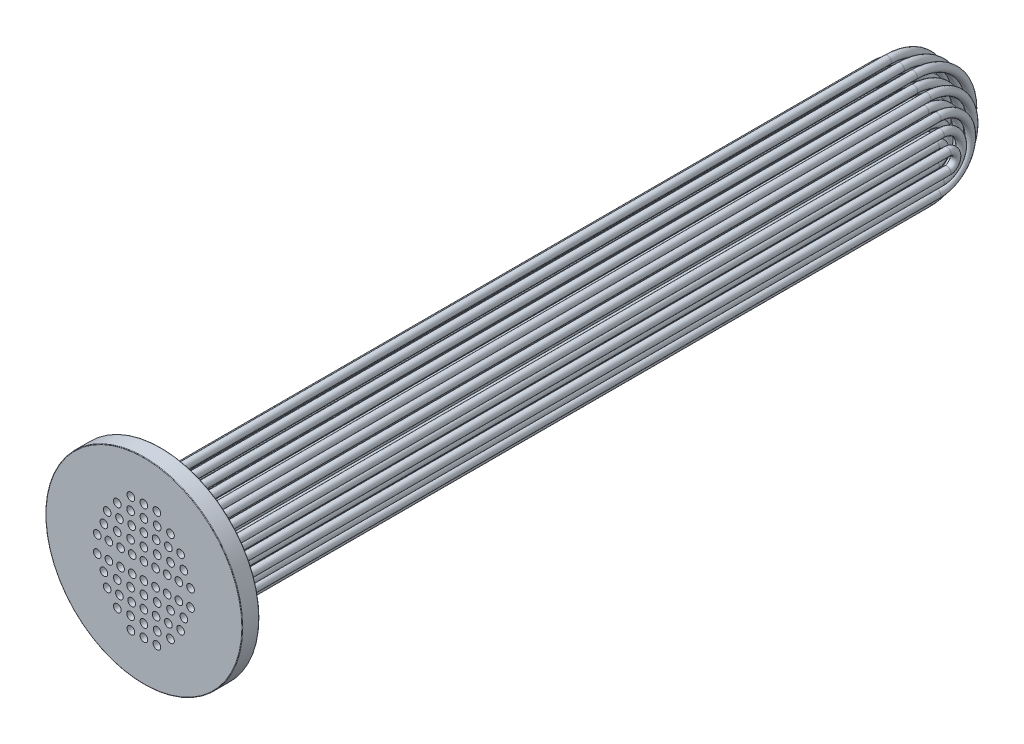
from build123d import *

# Parameters (mm, degrees)
SKETCH1_R            = 295.275
BOSS_EXTRUDE1_DEPTH  = 50.8
FILLET2_R            = 1.5875
SKETCH8_R            = 11.5
CUT_EXTRUDE4_DEPTH   = 552
SWEEP7_PROFILE_R     = 11.5
SWEEP8_PROFILE_R     = 11.5
SWEEP9_PROFILE_R     = 11.5
SWEEP10_PROFILE_R    = 11.5
SWEEP11_PROFILE_R    = 11.5
CUT_SWEEP3_PROFILE_R = 9
CUT_SWEEP4_PROFILE_R = 9
CUT_SWEEP5_PROFILE_R = 9
CUT_SWEEP6_PROFILE_R = 9
CUT_SWEEP7_PROFILE_R = 9
LPATTERN12_COUNT     = 3
LPATTERN12_PITCH     = 39
LPATTERN13_COUNT     = 5
LPATTERN13_PITCH     = 39.9
LPATTERN14_COUNT     = 7
LPATTERN14_PITCH     = 36.7
LPATTERN15_COUNT     = 9
LPATTERN15_PITCH     = 35
LPATTERN16_COUNT     = 7
LPATTERN16_PITCH     = 40


with BuildPart() as part:
    # Sketch1 → Boss-Extrude1 (new body)
    with BuildSketch(Plane.XY):
        Circle(SKETCH1_R)
    extrude(amount=BOSS_EXTRUDE1_DEPTH)

    # Fillet2
    fillet2_edges = [part.edges().sort_by_distance(p)[0] for p in [
        (-295.275, 0, 50.8),
        (-295.275, 0, 0),
    ]]
    fillet(fillet2_edges, radius=FILLET2_R)

    # Sketch8 → Cut-Extrude4 (cut)
    with BuildSketch(Plane.XY.offset(50.8)):
        with Locations((0, 25)):
            Circle(SKETCH8_R)
        with Locations((35, 25)):
            Circle(SKETCH8_R)
        with Locations((70, 25)):
            Circle(SKETCH8_R)
        with Locations((105, 25)):
            Circle(SKETCH8_R)
        with Locations((140, 25)):
            Circle(SKETCH8_R)
        with Locations((-35, 25)):
            Circle(SKETCH8_R)
        with Locations((-70, 25)):
            Circle(SKETCH8_R)
        with Locations((-105, 25)):
            Circle(SKETCH8_R)
        with Locations((-140, 25)):
            Circle(SKETCH8_R)
        with Locations((0, 62.2)):
            Circle(SKETCH8_R)
        with Locations((0, 99.4)):
            Circle(SKETCH8_R)
        with Locations((0, 136.6)):
            Circle(SKETCH8_R)
        with Locations((0, 173.8)):
            Circle(SKETCH8_R)
        with Locations((40, 62.2)):
            Circle(SKETCH8_R)
        with Locations((80, 62.2)):
            Circle(SKETCH8_R)
        with Locations((120, 62.2)):
            Circle(SKETCH8_R)
        with Locations((-40, 62.2)):
            Circle(SKETCH8_R)
        with Locations((-80, 62.2)):
            Circle(SKETCH8_R)
        with Locations((-120, 62.2)):
            Circle(SKETCH8_R)
        with Locations((36.7, 99.4)):
            Circle(SKETCH8_R)
        with Locations((73.4, 99.4)):
            Circle(SKETCH8_R)
        with Locations((110.1, 99.4)):
            Circle(SKETCH8_R)
        with Locations((-36.7, 99.4)):
            Circle(SKETCH8_R)
        with Locations((-73.4, 99.4)):
            Circle(SKETCH8_R)
        with Locations((-110.1, 99.4)):
            Circle(SKETCH8_R)
        with Locations((39.9, 136.6)):
            Circle(SKETCH8_R)
        with Locations((79.8, 136.6)):
            Circle(SKETCH8_R)
        with Locations((-39.9, 136.6)):
            Circle(SKETCH8_R)
        with Locations((-79.8, 136.6)):
            Circle(SKETCH8_R)
        with Locations((39, 173.8)):
            Circle(SKETCH8_R)
        with Locations((-140, -25)):
            Circle(SKETCH8_R)
        with Locations((-105, -25)):
            Circle(SKETCH8_R)
        with Locations((-70, -25)):
            Circle(SKETCH8_R)
        with Locations((-35, -25)):
            Circle(SKETCH8_R)
        with Locations((140, -25)):
            Circle(SKETCH8_R)
        with Locations((105, -25)):
            Circle(SKETCH8_R)
        with Locations((70, -25)):
            Circle(SKETCH8_R)
        with Locations((35, -25)):
            Circle(SKETCH8_R)
        with Locations((0, -25)):
            Circle(SKETCH8_R)
        with Locations((-110.1, -99.4)):
            Circle(SKETCH8_R)
        with Locations((-73.4, -99.4)):
            Circle(SKETCH8_R)
        with Locations((-36.7, -99.4)):
            Circle(SKETCH8_R)
        with Locations((110.1, -99.4)):
            Circle(SKETCH8_R)
        with Locations((73.4, -99.4)):
            Circle(SKETCH8_R)
        with Locations((36.7, -99.4)):
            Circle(SKETCH8_R)
        with Locations((-120, -62.2)):
            Circle(SKETCH8_R)
        with Locations((-80, -62.2)):
            Circle(SKETCH8_R)
        with Locations((-40, -62.2)):
            Circle(SKETCH8_R)
        with Locations((120, -62.2)):
            Circle(SKETCH8_R)
        with Locations((80, -62.2)):
            Circle(SKETCH8_R)
        with Locations((40, -62.2)):
            Circle(SKETCH8_R)
        with Locations((0, -99.4)):
            Circle(SKETCH8_R)
        with Locations((0, -62.2)):
            Circle(SKETCH8_R)
        with Locations((-39, -173.8)):
            Circle(SKETCH8_R)
        with Locations((39, -173.8)):
            Circle(SKETCH8_R)
        with Locations((-79.8, -136.6)):
            Circle(SKETCH8_R)
        with Locations((-39.9, -136.6)):
            Circle(SKETCH8_R)
        with Locations((79.8, -136.6)):
            Circle(SKETCH8_R)
        with Locations((39.9, -136.6)):
            Circle(SKETCH8_R)
        with Locations((0, -173.8)):
            Circle(SKETCH8_R)
        with Locations((0, -136.6)):
            Circle(SKETCH8_R)
        with Locations((-39, 173.8)):
            Circle(SKETCH8_R)
    extrude(amount=-CUT_EXTRUDE4_DEPTH, mode=Mode.SUBTRACT)


with BuildPart() as body_2:
    # Sweep7: sweep along a curve in space
    with BuildLine() as sweep7_path:
        Line((140, 25, 0), (140, 25, -2220))
        ThreePointArc((140, 25, -2220), (140, 0, -2245), (140, -25, -2220))
        Line((140, -25, 0), (140, -25, -2220))
    # Sweep7 profile (on start of the path) → Sweep7 (sweep)
    with BuildSketch(Plane(origin=(140, 25, 0), x_dir=(-1, 0, 0), z_dir=(0, 0, -1))):
        Circle(SWEEP7_PROFILE_R)
    sweep(path=sweep7_path.line)

    # Cut-Sweep3: sweep along a curve in space
    with BuildLine() as cut_sweep3_path:
        Line((140, 25, 0), (140, 25, -2220))
        ThreePointArc((140, 25, -2220), (140, 0, -2245), (140, -25, -2220))
        Line((140, -25, 0), (140, -25, -2220))
    # Cut-Sweep3 profile (on start of the path) → Cut-Sweep3 (sweep, cut)
    with BuildSketch(Plane(origin=(140, 25, 0), x_dir=(-1, 0, 0), z_dir=(0, 0, -1))):
        Circle(CUT_SWEEP3_PROFILE_R)
    sweep(path=cut_sweep3_path.line, mode=Mode.SUBTRACT)


with BuildPart() as body_3:
    # Sweep8: sweep along a curve in space
    with BuildLine() as sweep8_path:
        Line((120, 62.2, 0), (120, 62.2, -2220))
        ThreePointArc((120, 62.2, -2220), (120, 0, -2282.2), (120, -62.2, -2220))
        Line((120, -62.2, 0), (120, -62.2, -2220))
    # Sweep8 profile (on start of the path) → Sweep8 (sweep)
    with BuildSketch(Plane(origin=(120, 62.2, 0), x_dir=(-1, 0, 0), z_dir=(0, 0, -1))):
        Circle(SWEEP8_PROFILE_R)
    sweep(path=sweep8_path.line)

    # Cut-Sweep4: sweep along a curve in space
    with BuildLine() as cut_sweep4_path:
        Line((120, 62.2, 0), (120, 62.2, -2220))
        ThreePointArc((120, 62.2, -2220), (120, 0, -2282.2), (120, -62.2, -2220))
        Line((120, -62.2, 0), (120, -62.2, -2220))
    # Cut-Sweep4 profile (on start of the path) → Cut-Sweep4 (sweep, cut)
    with BuildSketch(Plane(origin=(120, 62.2, 0), x_dir=(-1, 0, 0), z_dir=(0, 0, -1))):
        Circle(CUT_SWEEP4_PROFILE_R)
    sweep(path=cut_sweep4_path.line, mode=Mode.SUBTRACT)


with BuildPart() as body_4:
    # Sweep9: sweep along a curve in space
    with BuildLine() as sweep9_path:
        Line((110.1, 99.4, 0), (110.1, 99.4, -2220))
        ThreePointArc((110.1, 99.4, -2220), (110.1, 0, -2319.4), (110.1, -99.4, -2220))
        Line((110.1, -99.4, 0), (110.1, -99.4, -2220))
    # Sweep9 profile (on start of the path) → Sweep9 (sweep)
    with BuildSketch(Plane(origin=(110.1, 99.4, 0), x_dir=(-1, 0, 0), z_dir=(0, 0, -1))):
        Circle(SWEEP9_PROFILE_R)
    sweep(path=sweep9_path.line)

    # Cut-Sweep5: sweep along a curve in space
    with BuildLine() as cut_sweep5_path:
        Line((110.1, 99.4, 0), (110.1, 99.4, -2220))
        ThreePointArc((110.1, 99.4, -2220), (110.1, 0, -2319.4), (110.1, -99.4, -2220))
        Line((110.1, -99.4, 0), (110.1, -99.4, -2220))
    # Cut-Sweep5 profile (on start of the path) → Cut-Sweep5 (sweep, cut)
    with BuildSketch(Plane(origin=(110.1, 99.4, 0), x_dir=(-1, 0, 0), z_dir=(0, 0, -1))):
        Circle(CUT_SWEEP5_PROFILE_R)
    sweep(path=cut_sweep5_path.line, mode=Mode.SUBTRACT)


with BuildPart() as body_5:
    # Sweep10: sweep along a curve in space
    with BuildLine() as sweep10_path:
        Line((79.8, 136.6, 0), (79.8, 136.6, -2220))
        ThreePointArc((79.8, 136.6, -2220), (79.8, 0, -2356.6), (79.8, -136.6, -2220))
        Line((79.8, -136.6, 0), (79.8, -136.6, -2220))
    # Sweep10 profile (on start of the path) → Sweep10 (sweep)
    with BuildSketch(Plane(origin=(79.8, 136.6, 0), x_dir=(-1, 0, 0), z_dir=(0, 0, -1))):
        Circle(SWEEP10_PROFILE_R)
    sweep(path=sweep10_path.line)

    # Cut-Sweep6: sweep along a curve in space
    with BuildLine() as cut_sweep6_path:
        Line((79.8, 136.6, 0), (79.8, 136.6, -2220))
        ThreePointArc((79.8, 136.6, -2220), (79.8, 0, -2356.6), (79.8, -136.6, -2220))
        Line((79.8, -136.6, 0), (79.8, -136.6, -2220))
    # Cut-Sweep6 profile (on start of the path) → Cut-Sweep6 (sweep, cut)
    with BuildSketch(Plane(origin=(79.8, 136.6, 0), x_dir=(-1, 0, 0), z_dir=(0, 0, -1))):
        Circle(CUT_SWEEP6_PROFILE_R)
    sweep(path=cut_sweep6_path.line, mode=Mode.SUBTRACT)


with BuildPart() as body_6:
    # Sweep11: sweep along a curve in space
    with BuildLine() as sweep11_path:
        Line((39, 173.8, 0), (39, 173.8, -2220))
        ThreePointArc((39, 173.8, -2220), (39, 0, -2393.8), (39, -173.8, -2220))
        Line((39, -173.8, 0), (39, -173.8, -2220))
    # Sweep11 profile (on start of the path) → Sweep11 (sweep)
    with BuildSketch(Plane(origin=(39, 173.8, 0), x_dir=(-1, 0, 0), z_dir=(0, 0, -1))):
        Circle(SWEEP11_PROFILE_R)
    sweep(path=sweep11_path.line)

    # Cut-Sweep7: sweep along a curve in space
    with BuildLine() as cut_sweep7_path:
        Line((39, 173.8, 0), (39, 173.8, -2220))
        ThreePointArc((39, 173.8, -2220), (39, 0, -2393.8), (39, -173.8, -2220))
        Line((39, -173.8, 0), (39, -173.8, -2220))
    # Cut-Sweep7 profile (on start of the path) → Cut-Sweep7 (sweep, cut)
    with BuildSketch(Plane(origin=(39, 173.8, 0), x_dir=(-1, 0, 0), z_dir=(0, 0, -1))):
        Circle(CUT_SWEEP7_PROFILE_R)
    sweep(path=cut_sweep7_path.line, mode=Mode.SUBTRACT)


with BuildPart() as lpattern12_1:
    # LPattern12: pattern copy
    add(body_6.part.moved(Location(Vector(-1, 0, 0) * (1 * LPATTERN12_PITCH))))


with BuildPart() as lpattern12_2:
    # LPattern12: pattern copy
    add(body_6.part.moved(Location(Vector(-1, 0, 0) * (2 * LPATTERN12_PITCH))))


with BuildPart() as lpattern13_1:
    # LPattern13: pattern copy
    add(body_5.part.moved(Location(Vector(-1, 0, 0) * (1 * LPATTERN13_PITCH))))


with BuildPart() as lpattern13_2:
    # LPattern13: pattern copy
    add(body_5.part.moved(Location(Vector(-1, 0, 0) * (2 * LPATTERN13_PITCH))))


with BuildPart() as lpattern13_3:
    # LPattern13: pattern copy
    add(body_5.part.moved(Location(Vector(-1, 0, 0) * (3 * LPATTERN13_PITCH))))


with BuildPart() as lpattern13_4:
    # LPattern13: pattern copy
    add(body_5.part.moved(Location(Vector(-1, 0, 0) * (4 * LPATTERN13_PITCH))))


with BuildPart() as lpattern14_1:
    # LPattern14: pattern copy
    add(body_4.part.moved(Location(Vector(-1, 0, 0) * (1 * LPATTERN14_PITCH))))


with BuildPart() as lpattern14_2:
    # LPattern14: pattern copy
    add(body_4.part.moved(Location(Vector(-1, 0, 0) * (2 * LPATTERN14_PITCH))))


with BuildPart() as lpattern14_3:
    # LPattern14: pattern copy
    add(body_4.part.moved(Location(Vector(-1, 0, 0) * (3 * LPATTERN14_PITCH))))


with BuildPart() as lpattern14_4:
    # LPattern14: pattern copy
    add(body_4.part.moved(Location(Vector(-1, 0, 0) * (4 * LPATTERN14_PITCH))))


with BuildPart() as lpattern14_5:
    # LPattern14: pattern copy
    add(body_4.part.moved(Location(Vector(-1, 0, 0) * (5 * LPATTERN14_PITCH))))


with BuildPart() as lpattern14_6:
    # LPattern14: pattern copy
    add(body_4.part.moved(Location(Vector(-1, 0, 0) * (6 * LPATTERN14_PITCH))))


with BuildPart() as lpattern15_1:
    # LPattern15: pattern copy
    add(body_2.part.moved(Location(Vector(-1, 0, 0) * (1 * LPATTERN15_PITCH))))


with BuildPart() as lpattern15_2:
    # LPattern15: pattern copy
    add(body_2.part.moved(Location(Vector(-1, 0, 0) * (2 * LPATTERN15_PITCH))))


with BuildPart() as lpattern15_3:
    # LPattern15: pattern copy
    add(body_2.part.moved(Location(Vector(-1, 0, 0) * (3 * LPATTERN15_PITCH))))


with BuildPart() as lpattern15_4:
    # LPattern15: pattern copy
    add(body_2.part.moved(Location(Vector(-1, 0, 0) * (4 * LPATTERN15_PITCH))))


with BuildPart() as lpattern15_5:
    # LPattern15: pattern copy
    add(body_2.part.moved(Location(Vector(-1, 0, 0) * (5 * LPATTERN15_PITCH))))


with BuildPart() as lpattern15_6:
    # LPattern15: pattern copy
    add(body_2.part.moved(Location(Vector(-1, 0, 0) * (6 * LPATTERN15_PITCH))))


with BuildPart() as lpattern15_7:
    # LPattern15: pattern copy
    add(body_2.part.moved(Location(Vector(-1, 0, 0) * (7 * LPATTERN15_PITCH))))


with BuildPart() as lpattern15_8:
    # LPattern15: pattern copy
    add(body_2.part.moved(Location(Vector(-1, 0, 0) * (8 * LPATTERN15_PITCH))))


with BuildPart() as lpattern16_1:
    # LPattern16: pattern copy
    add(body_3.part.moved(Location(Vector(-1, 0, 0) * (1 * LPATTERN16_PITCH))))


with BuildPart() as lpattern16_2:
    # LPattern16: pattern copy
    add(body_3.part.moved(Location(Vector(-1, 0, 0) * (2 * LPATTERN16_PITCH))))


with BuildPart() as lpattern16_3:
    # LPattern16: pattern copy
    add(body_3.part.moved(Location(Vector(-1, 0, 0) * (3 * LPATTERN16_PITCH))))


with BuildPart() as lpattern16_4:
    # LPattern16: pattern copy
    add(body_3.part.moved(Location(Vector(-1, 0, 0) * (4 * LPATTERN16_PITCH))))


with BuildPart() as lpattern16_5:
    # LPattern16: pattern copy
    add(body_3.part.moved(Location(Vector(-1, 0, 0) * (5 * LPATTERN16_PITCH))))


with BuildPart() as lpattern16_6:
    # LPattern16: pattern copy
    add(body_3.part.moved(Location(Vector(-1, 0, 0) * (6 * LPATTERN16_PITCH))))


solid = Compound([part.part, body_2.part, body_3.part, body_4.part, body_5.part, body_6.part, lpattern12_1.part, lpattern12_2.part, lpattern13_1.part, lpattern13_2.part, lpattern13_3.part, lpattern13_4.part, lpattern14_1.part, lpattern14_2.part, lpattern14_3.part, lpattern14_4.part, lpattern14_5.part, lpattern14_6.part, lpattern15_1.part, lpattern15_2.part, lpattern15_3.part, lpattern15_4.part, lpattern15_5.part, lpattern15_6.part, lpattern15_7.part, lpattern15_8.part, lpattern16_1.part, lpattern16_2.part, lpattern16_3.part, lpattern16_4.part, lpattern16_5.part, lpattern16_6.part])
